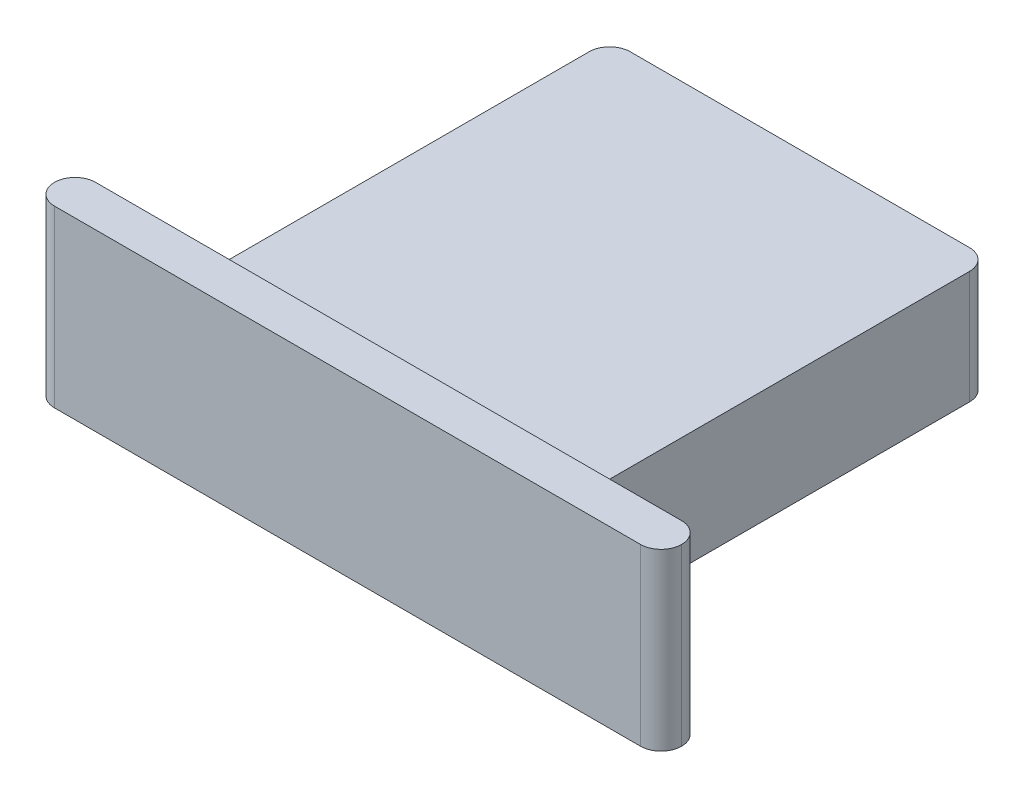
from build123d import *

# Parameters (mm, degrees)
CROQUIS1_W              = 18.5
CROQUIS1_H              = 5.5
SALIENTE_EXTRUIR1_DEPTH = 20
CROQUIS4_R              = 7
CORTAR_EXTRUIR1_DEPTH   = 1
CROQUIS5_W              = 30.5
CROQUIS5_H              = 8.5
SALIENTE_EXTRUIR2_DEPTH = 2
REDONDEO2_R             = 1
REDONDEO3_R             = 1
REDONDEO4_R             = 1
REDONDEO5_R             = 1
CROQUIS6_R              = 2
CORTAR_EXTRUIR2_DEPTH   = 4
REDONDEO6_R             = 1
REDONDEO7_R             = 1


with BuildPart() as part:
    # Croquis1 → Saliente-Extruir1 (new body)
    with BuildSketch(Plane.XY):
        Rectangle(CROQUIS1_W, CROQUIS1_H)
    extrude(amount=SALIENTE_EXTRUIR1_DEPTH)

    # Croquis4 → Cortar-Extruir1 (cut)
    with BuildSketch(Plane.XZ.offset(2.75)):
        with Locations((0, 11.5)):
            Circle(CROQUIS4_R)
    extrude(amount=-CORTAR_EXTRUIR1_DEPTH, mode=Mode.SUBTRACT)

    # Croquis5 → Saliente-Extruir2 (add)
    with BuildSketch(Plane.XY.offset(20)):
        Rectangle(CROQUIS5_W, CROQUIS5_H)
    extrude(amount=SALIENTE_EXTRUIR2_DEPTH)

    # Redondeo2
    redondeo2_edges = [part.edges().sort_by_distance(p)[0] for p in [
        (-15.25, 0, 22),
    ]]
    fillet(redondeo2_edges, radius=REDONDEO2_R)

    # Redondeo3
    redondeo3_edges = [part.edges().sort_by_distance(p)[0] for p in [
        (-15.25, 0, 20),
    ]]
    fillet(redondeo3_edges, radius=REDONDEO3_R - 0.0001)  # a hair under: the kernel refuses the full size

    # Redondeo4
    redondeo4_edges = [part.edges().sort_by_distance(p)[0] for p in [
        (15.25, 0, 22),
    ]]
    fillet(redondeo4_edges, radius=REDONDEO4_R)

    # Redondeo5
    redondeo5_edges = [part.edges().sort_by_distance(p)[0] for p in [
        (15.25, 0, 20),
    ]]
    fillet(redondeo5_edges, radius=REDONDEO5_R - 0.0001)  # a hair under: the kernel refuses the full size

    # Croquis6 → Cortar-Extruir2 (cut)
    with BuildSketch(Plane(origin=(0, 0, 0), x_dir=(-1, 0, 0), z_dir=(0, 0, -1))):
        Circle(CROQUIS6_R)
    extrude(amount=-CORTAR_EXTRUIR2_DEPTH, mode=Mode.SUBTRACT)

    # Redondeo6
    redondeo6_edges = [part.edges().sort_by_distance(p)[0] for p in [
        (-9.25, 0, 0),
    ]]
    fillet(redondeo6_edges, radius=REDONDEO6_R)

    # Redondeo7
    redondeo7_edges = [part.edges().sort_by_distance(p)[0] for p in [
        (9.25, 0, 0),
    ]]
    fillet(redondeo7_edges, radius=REDONDEO7_R)


solid = part.part
